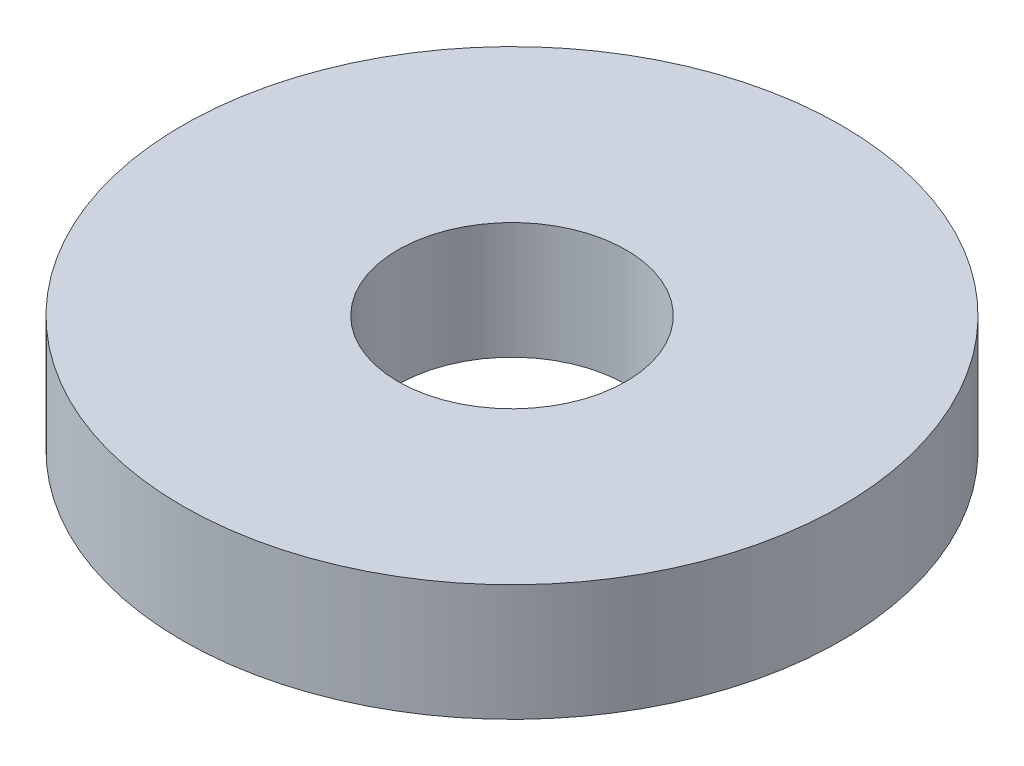
from build123d import *

# Parameters (mm, degrees)
SKETCH1_R           = 65
BOSS_EXTRUDE1_DEPTH = 23
SKETCH2_R           = 22.5
CUT_EXTRUDE1_DEPTH  = 95.757585448


with BuildPart() as part:
    # Sketch1 → Boss-Extrude1 (new body)
    with BuildSketch(Plane(origin=(0, 0, 0), x_dir=(1, 0, 0), z_dir=(0, 1, 0))):
        Circle(SKETCH1_R)
    extrude(amount=BOSS_EXTRUDE1_DEPTH)

    # Sketch2 → Cut-Extrude1 (cut, through all)
    with BuildSketch(Plane(origin=(0, 0, 0), x_dir=(1, 0, 0), z_dir=(0, 1, 0))):
        Circle(SKETCH2_R)
    extrude(amount=CUT_EXTRUDE1_DEPTH, mode=Mode.SUBTRACT)


solid = part.part
